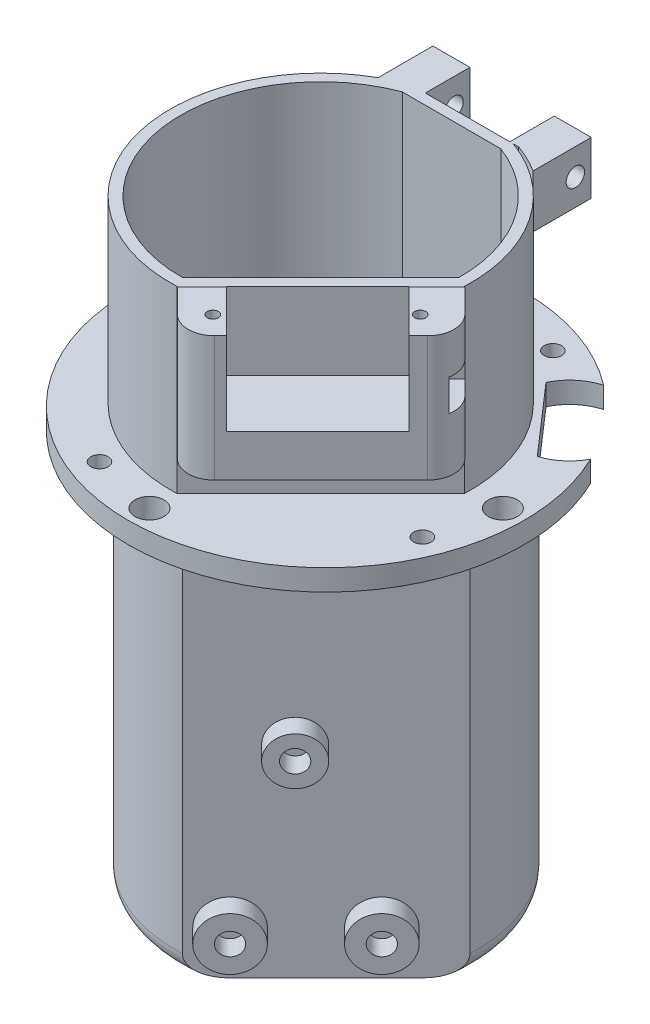
from build123d import *

# Parameters (mm, degrees)
SKETCH1_R            = 37.500000000000014
BOSS_EXTRUDE1_DEPTH  = 4
BOSS_EXTRUDE2_DEPTH  = 34
SKETCH5_R            = 2.7499999996325837
SKETCH5_R_2          = 2.75
SKETCH5_R_3          = 2.7500000000258247
SKETCH5_R_4          = 2.749999999658416
SKETCH5_R_5          = 1.6500000000000001
SKETCH5_R_6          = 1.6499999999999988
SKETCH5_R_7          = 1.6499999999999957
CUT_EXTRUDE2_DEPTH   = 10
BOSS_EXTRUDE6_DEPTH  = 75
SHELL1_T             = -2
CUT_EXTRUDE3_DEPTH   = 10
FILLET1_R            = 4
BOSS_EXTRUDE9_DEPTH  = 10
SKETCH21_R           = 1.7500000000000104
CUT_EXTRUDE5_DEPTH   = 40
BOSS_EXTRUDE13_DEPTH = 12.999999999999998
FILLET2_R            = 5
SKETCH28_R           = 1.05
SKETCH28_R_2         = 1.049999999999999
CUT_EXTRUDE11_DEPTH  = 5.999999999999993
SKETCH29_R           = 3.25
CUT_EXTRUDE12_DEPTH  = 5.999999999999993
SKETCH31_W           = 8
SKETCH31_H           = 5.999999999999993
CUT_EXTRUDE13_DEPTH  = 10
BOSS_EXTRUDE14_START = -28
BOSS_EXTRUDE14_DEPTH = 10
SKETCH33_R           = 4.9999999999920695
SKETCH33_R_2         = 4.499999999992068
BOSS_EXTRUDE15_DEPTH = 3.86
SKETCH34_R           = 2.0999999999920713
SKETCH34_R_2         = 2.099999999992072
SKETCH34_R_3         = 2.0999999999920704
CUT_EXTRUDE14_DEPTH  = 4.2
CUT_EXTRUDE15_DEPTH  = 6
CUT_EXTRUDE16_DEPTH  = 1.082123817


with BuildPart() as part:
    # Sketch1 → Boss-Extrude1 (new body)
    with BuildSketch(Plane(origin=(0, 0, 0), x_dir=(1, 0, 0), z_dir=(0, 1, 0))):
        with Locations(Location((0, 0, 0), (0, 0, 270))):
            Circle(SKETCH1_R)
    extrude(amount=BOSS_EXTRUDE1_DEPTH)

    # Sketch3 → Boss-Extrude2 (add)
    with BuildSketch(Plane(origin=(0, 4, 0), x_dir=(1, 0, 0), z_dir=(0, 1, 0))):
        with BuildLine():
            Line((27.43260268125508, -1.224872854444847), (0.18369490524426094, -28.473671452031667))
            ThreePointArc((0.18369490524426094, -28.473671452031667), (-29.000581799821436, -5.524070669091407), (-10.736939275039097, 26.800000000011135))
            Line((-10.736939275039097, 26.800000000011135), (8.654811548442561, 26.800000000011135))
            ThreePointArc((8.654811548442561, 26.800000000011135), (22.63544047994107, 15.864209469271458), (27.43260268125508, -1.224872854444847))
        make_face()
        with BuildLine():
            Line((25.45631471019754, -0.37273144868234936), (-0.6684385820861921, -26.49738006670114))
            ThreePointArc((-0.6684385820861921, -26.49738006670114), (-27.07858694278502, -4.929238469082694), (-10.379693313062322, 24.80000000001113))
            Line((-10.379693313062322, 24.80000000001113), (8.297565586465787, 24.80000000001113))
            ThreePointArc((8.297565586465787, 24.80000000001113), (20.85577312079139, 14.925767320058823), (25.45631471019754, -0.37273144868234936))
        make_face(mode=Mode.SUBTRACT)
    extrude(amount=BOSS_EXTRUDE2_DEPTH)

    # Sketch5 → Cut-Extrude2 (cut)
    with BuildSketch(Plane(origin=(0, 4, 0), x_dir=(1, 0, 0), z_dir=(0, 1, 0))):
        with Locations(Location((-33.49492446290215, 0.00013411391513071, 0), (0, 0, 270))):
            Circle(SKETCH5_R)
        with Locations(Location((-0.00013356723643175, 33.494790805725295, 0), (0, 0, 270))):
            Circle(SKETCH5_R_2)
        with Locations(Location((33.494523124573746, -8.994042047e-08, 0), (0, 0, 270))):
            Circle(SKETCH5_R_3)
        with Locations(Location((-0.00026777109197641, -33.49465678175059, 0), (0, 0, 270))):
            Circle(SKETCH5_R_4)
        with Locations(Location((-12.362017582725011, -30.59706720070402, 0), (0, 0, 270))):
            Circle(SKETCH5_R_5)
        with Locations(Location((-30.59706720070398, 12.362017582725123, 0), (0, 0, 270))):
            Circle(SKETCH5_R_6)
        with Locations(Location((12.362017582725228, 30.59706720070393, 0), (0, 0, 270))):
            Circle(SKETCH5_R_5)
        with Locations(Location((30.597067200703897, -12.362017582725326, 0), (0, 0, 270))):
            Circle(SKETCH5_R_7)
    extrude(amount=-CUT_EXTRUDE2_DEPTH, mode=Mode.SUBTRACT)

    # Sketch16 → Cut-Extrude3 (cut)
    with BuildSketch(Plane(origin=(0, 4, 0), x_dir=(1, 0, 0), z_dir=(0, 1, 0))):
        with BuildLine():
            Line((0.3726252811901698, -26.49738006670113), (26.4973785734739, -0.3727314486823372))
            ThreePointArc((26.4973785734739, -0.3727314486823372), (-18.738292161801, 18.738367240979606), (0.3726252811901698, -26.49738006670113))
        make_face()
    extrude(amount=-CUT_EXTRUDE3_DEPTH, mode=Mode.SUBTRACT)

    # Sketch18 → Boss-Extrude9 (add)
    with BuildSketch(Plane(origin=(0, 38.00000000000001, 0), x_dir=(1, 0, 0), z_dir=(0, 1, 0))):
        with BuildLine():
            Line((15, 24.233241632102853), (14.999999999999998, 35.23324163210285))
            Line((14.999999999999998, 35.23324163210285), (7.9999999999999964, 35.23324163210285))
            Line((7.9999999999999964, 35.23324163210285), (7.999999999999998, 26.80000000001115))
            Line((7.999999999999998, 26.80000000001115), (9.695875411718896, 26.80000000001115))
            ThreePointArc((9.695875411718896, 26.80000000001115), (12.414452372843087, 25.654071261350285), (15, 24.233241632102853))
        make_face()
        with BuildLine():
            Line((-7.9999999999999964, 35.23324163210285), (-7.999999999999998, 26.800000000011156))
            Line((-7.999999999999998, 26.800000000011156), (-9.695875411762707, 26.800000000011156))
            ThreePointArc((-9.695875411762707, 26.800000000011156), (-12.414452372860087, 25.65407126133764), (-15, 24.233241632102853))
            Line((-15, 24.233241632102853), (-14.999999999999998, 35.23324163210285))
            Line((-14.999999999999998, 35.23324163210285), (-7.9999999999999964, 35.23324163210285))
        make_face()
    extrude(amount=-BOSS_EXTRUDE9_DEPTH)

    # Sketch21 → Cut-Extrude5 (cut)
    with BuildSketch(Plane(origin=(15.000000000000004, 0, -2.37e-15), x_dir=(1.6e-16, 0, -1), z_dir=(1, 0, 1.6e-16))):
        with Locations((32.233241632105404, 33.000000000000185)):
            Circle(SKETCH21_R)
    extrude(amount=-CUT_EXTRUDE5_DEPTH, mode=Mode.SUBTRACT)

    # Sketch27 → Boss-Extrude13 (add)
    with BuildSketch(Plane(origin=(14.328682810517009, 0, 14.328740221598881), x_dir=(0.7071081977732587, 0, -0.7071053645969985), z_dir=(0.7071053645969985, 0, 0.7071081977732587))):
        Polygon((-13.356558336469002, 23.382123816577263), (-13.356558336469002, 39.082123816577024), (-19.94256467636435, 39.082123816577024), (-19.94256467636435, 15.382123816577272), (18.593133059597207, 15.382123816577272), (18.5931330595972, 39.082123816577024), (11.123133059597205, 39.082123816577024), (11.123133059597208, 23.382123816577263), align=None)
    extrude(amount=BOSS_EXTRUDE13_DEPTH)

    # Fillet2
    fillet2_edges = [part.edges().sort_by_distance(p)[0] for p in [
        (36.66840935900816, 27.23212381657715, 10.373842661544257),
        (9.419501582997341, 27.232123816577147, 37.62264125913108),
    ]]
    fillet(fillet2_edges, radius=FILLET2_R)

    # Sketch28 → Cut-Extrude11 (cut)
    with BuildSketch(Plane(origin=(0, 39.082123816577024, 0), x_dir=(1, 0, 0), z_dir=(0, 1, 0))):
        with Locations(Location((9.316450186911645, -30.79605966921365, 0), (0, 0, 270))):
            Circle(SKETCH28_R)
        with Locations(Location((28.97405808500825, -11.138530533417102, 0), (0, 0, 270))):
            Circle(SKETCH28_R_2)
    extrude(amount=-CUT_EXTRUDE11_DEPTH, mode=Mode.SUBTRACT)

    # Sketch31 → Cut-Extrude13 (cut)
    with BuildSketch(Plane(origin=(13.14735680873018, 4.81e-15, -13.147304131106994), x_dir=(-0.7071053645969986, 0, -0.7071081977732586), z_dir=(0.7071081977732586, 0, -0.7071053645969986))):
        with Locations((-28.36385815738135, 28.661507762433622)):
            Rectangle(SKETCH31_W, SKETCH31_H)
    extrude(amount=-CUT_EXTRUDE13_DEPTH, mode=Mode.SUBTRACT)



with BuildPart() as body_2:
    # Sketch15 → Boss-Extrude6 (new body)
    with BuildSketch(Plane.XZ):
        with BuildLine():
            Line((28.473666544542198, 1.2248728544340861), (1.2247587685206183, 28.47367145203166))
            ThreePointArc((1.2247587685206183, 28.47367145203166), (-27.95951793651176, 5.524070669097932), (-9.695875411762707, -26.800000000011156))
            Line((-9.695875411762707, -26.800000000011156), (9.695875411718896, -26.80000000001115))
            ThreePointArc((9.695875411718896, -26.80000000001115), (23.676504343229105, -15.864209469281034), (28.473666544542198, 1.2248728544340861))
        make_face()
    extrude(amount=BOSS_EXTRUDE6_DEPTH)

    # Shell1
    shell1_openings = [body_2.faces().sort_by_distance(p)[0] for p in [
        (-1.446451, 0, -1.185792841),
    ]]
    offset(amount=SHELL1_T, openings=shell1_openings, kind=Kind.INTERSECTION)

    # Fillet1
    fillet1_edges = [body_2.edges().sort_by_distance(p)[0] for p in [
        (-27.95951793651426, -75, 5.524070669085284),
    ]]
    fillet(fillet1_edges, radius=FILLET1_R - 0.0001)  # a hair under: the kernel refuses the full size

    # Sketch29 → Cut-Extrude12 (cut)
    with BuildSketch(Plane(origin=(0, -73, 0), x_dir=(1, 0, 0), z_dir=(0, 1, 0))):
        with Locations(Location((0, 0, 0), (0, 0, 270))):
            Circle(SKETCH29_R)
    extrude(amount=-CUT_EXTRUDE12_DEPTH, mode=Mode.SUBTRACT)


with BuildPart() as part_1:
    add(part.part)

    add(body_2.part)  # Boss-Extrude14 merges body 2
    # Sketch32 → Boss-Extrude14 (add)
    with BuildSketch(Plane(origin=(0, 38.00000000000001, 0), x_dir=(1, 0, 0), z_dir=(0, 1, 0)).offset(BOSS_EXTRUDE14_START)):
        with BuildLine():
            Line((-9.338629449742895, 24.800000000011153), (9.338629449721768, 24.800000000011146))
            ThreePointArc((9.338629449721768, 24.800000000011146), (-9.8838e-12, 26.499999999995538), (-9.338629449742895, 24.800000000011153))
        make_face()
    extrude(amount=-BOSS_EXTRUDE14_DEPTH)

    # Sketch33 → Boss-Extrude15 (add)
    with BuildSketch(Plane(origin=(14.849212656531403, 0, 14.849272153232874), x_dir=(0.7071081977732585, 0, -0.7071053645969986), z_dir=(0.7071053645969986, 0, 0.7071081977732585))):
        with Locations(Location((-12.878558963055134, -66.6999115263342, 0), (0, 0, 180))):
            Circle(SKETCH33_R)
        with Locations(Location((7.461441036944884, -66.6999115263342, 0), (0, 0, 180))):
            Circle(SKETCH33_R)
        with Locations(Location((-4.153697003459532, -36.6999367707353, 0), (0, 0, 180))):
            Circle(SKETCH33_R_2)
    extrude(amount=BOSS_EXTRUDE15_DEPTH)

    # Sketch34 → Cut-Extrude14 (cut)
    with BuildSketch(Plane(origin=(17.578639363876515, -2.8e-15, 17.578709796638343), x_dir=(0.7071081977732586, 0, -0.7071053645969986), z_dir=(0.7071053645969986, 0, 0.7071081977732586))):
        with Locations((-4.153697003459547, -36.69993677073529)):
            Circle(SKETCH34_R)
        with Locations((7.46144103694487, -66.6999115263342)):
            Circle(SKETCH34_R_2)
        with Locations((-12.87855896305515, -66.69991152633419)):
            Circle(SKETCH34_R_3)
    extrude(amount=-CUT_EXTRUDE14_DEPTH, mode=Mode.SUBTRACT)

    # Sketch35 → Cut-Extrude15 (cut)
    with BuildSketch(Plane(origin=(0, 4, 0), x_dir=(1, 0, 0), z_dir=(0, 1, 0))):
        with BuildLine():
            Line((16.930501479421057, 24.731996700817078), (28.25712370299877, 11.758011181218741))
            ThreePointArc((28.25712370299877, 11.758011181218741), (32.49604489503215, 26.889906797281803), (16.930501479421057, 24.731996700817078))
        make_face()
    extrude(amount=-CUT_EXTRUDE15_DEPTH, mode=Mode.SUBTRACT)

    # Sketch36 → Cut-Extrude16 (cut)
    with BuildSketch(Plane(origin=(0, 39.082123816577024, 0), x_dir=(1, 0, 0), z_dir=(0, 1, 0))):
        Polygon((27.47603961924718, -1.181436090491898), (28.646536061254768, -2.3519372223451054), (1.397628285210752, -29.600735819898734), (0.22713184323636287, -28.430234688078716), align=None)
    extrude(amount=-CUT_EXTRUDE16_DEPTH, mode=Mode.SUBTRACT)


solid = part_1.part
